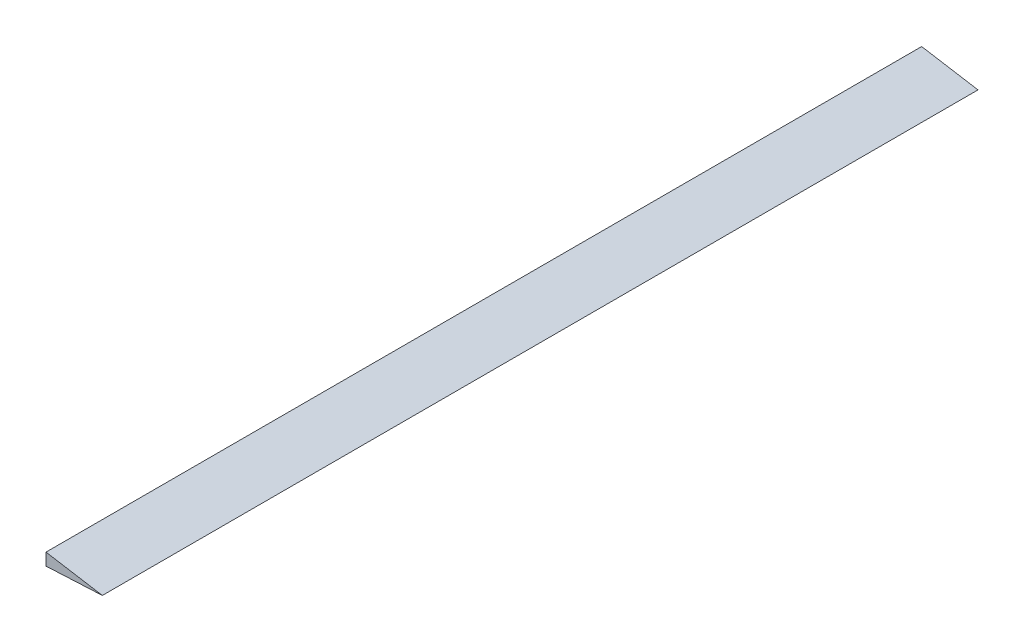
from build123d import *

# Parameters (mm, degrees)
BOSS_EXTRUDE2_DEPTH = 789.432


with BuildPart() as part:
    # Sketch2 → Boss-Extrude2 (new body)
    with BuildSketch(Plane(origin=(0, 0, -761.999746), x_dir=(-1, 0, 0), z_dir=(0, 0, -1))):
        Polygon((-306.8495768, -2.516115741), (-306.8495768, 8.449856001), (-357.6495768, 0), align=None)
    extrude(amount=-BOSS_EXTRUDE2_DEPTH)


solid = part.part
